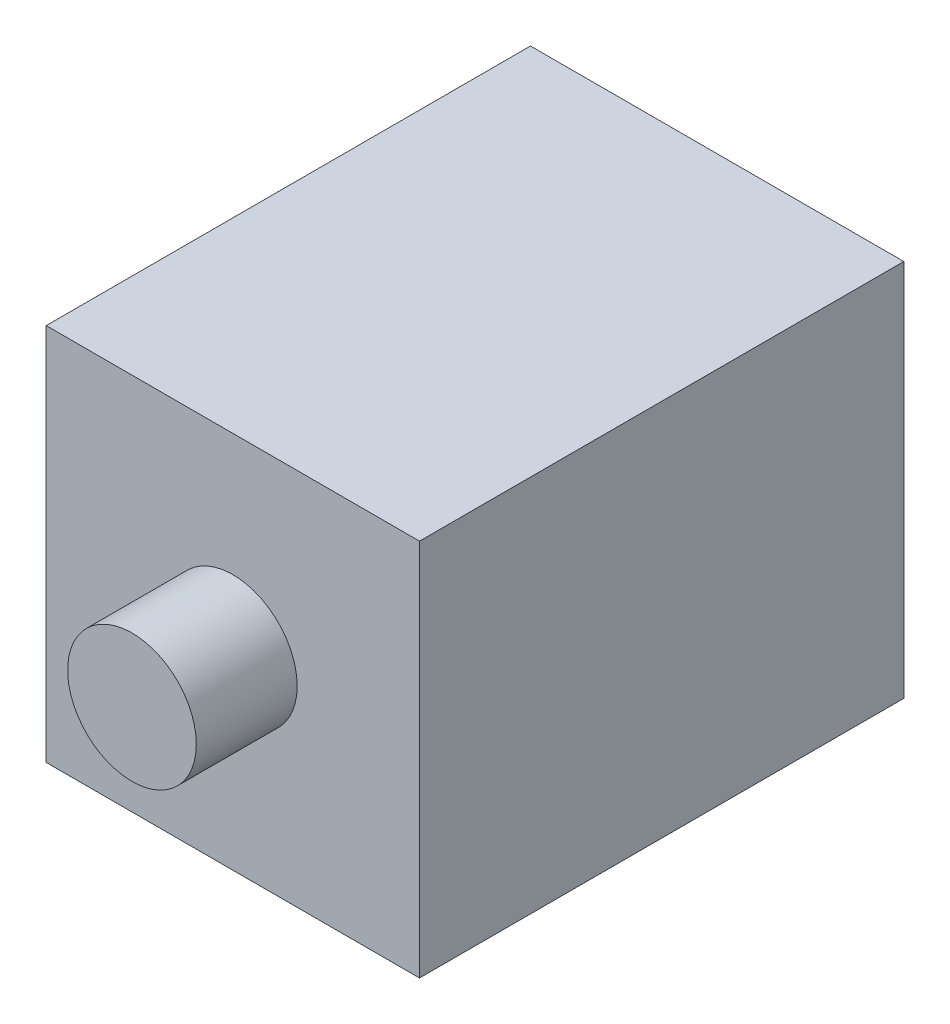
from build123d import *

# Parameters (mm, degrees)
ESQUISSE1_W        = 37
ESQUISSE1_H        = 37.5
BOSS_EXTRU_1_DEPTH = 48
ESQUISSE2_R        = 6.375
BOSS_EXTRU_2_DEPTH = 10


with BuildPart() as part:
    # Esquisse1 → Boss.-Extru.1 (new body)
    with BuildSketch(Plane.XY):
        with Locations((18.5, 18.75)):
            Rectangle(ESQUISSE1_W, ESQUISSE1_H)
    extrude(amount=BOSS_EXTRU_1_DEPTH)

    # Esquisse2 → Boss.-Extru.2 (add)
    with BuildSketch(Plane.XY.offset(48)):
        with Locations((18.5, 19)):
            Circle(ESQUISSE2_R)
    extrude(amount=BOSS_EXTRU_2_DEPTH)


solid = part.part
